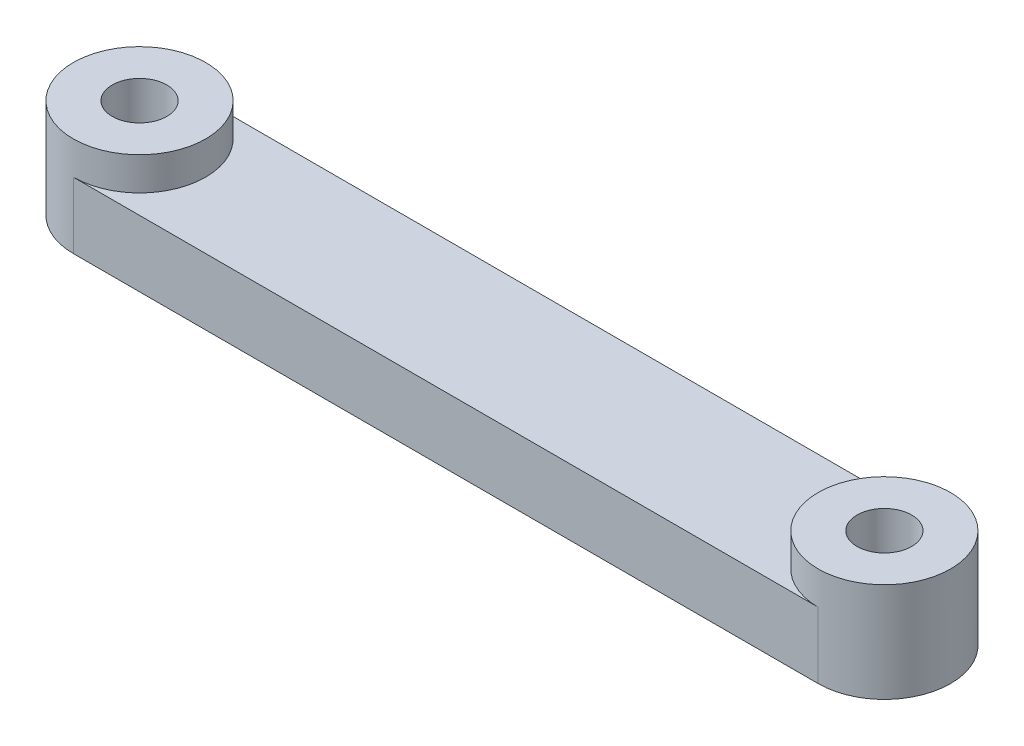
from build123d import *

# Parameters (mm, degrees)
SKETCH1_R           = 1.65
BOSS_EXTRUDE1_DEPTH = 4
SKETCH2_R           = 4
SKETCH2_R_2         = 1.65
BOSS_EXTRUDE2_DEPTH = 2


with BuildPart() as part:
    # Sketch1 → Boss-Extrude1 (new body)
    with BuildSketch(Plane(origin=(0, 0, 0), x_dir=(1, 0, 0), z_dir=(0, 1, 0))):
        with BuildLine():
            Line((-22.5, 4), (22.5, 4))
            ThreePointArc((22.5, 4), (26.5, 0), (22.5, -4))
            Line((22.5, -4), (-22.5, -4))
            ThreePointArc((-22.5, -4), (-26.5, 0), (-22.5, 4))
        make_face()
        with Locations((-22.5, 0)):
            Circle(SKETCH1_R, mode=Mode.SUBTRACT)
        with Locations((22.5, 0)):
            Circle(SKETCH1_R, mode=Mode.SUBTRACT)
    extrude(amount=BOSS_EXTRUDE1_DEPTH)

    # Sketch2 → Boss-Extrude2 (add)
    # profile 1 of 2: a face of its own
    with BuildSketch(Plane(origin=(0, 4, 0), x_dir=(1, 0, 0), z_dir=(0, 1, 0))):
        with Locations((-22.5, 0)):
            Circle(SKETCH2_R)
        with Locations((-22.5, 0)):
            Circle(SKETCH2_R_2, mode=Mode.SUBTRACT)
    # profile 2 of 2: a face of its own
    with BuildSketch(Plane(origin=(0, 4, 0), x_dir=(1, 0, 0), z_dir=(0, 1, 0))):
        with Locations((22.5, 0)):
            Circle(SKETCH2_R)
        with Locations((22.5, 0)):
            Circle(SKETCH2_R_2, mode=Mode.SUBTRACT)
    extrude(amount=BOSS_EXTRUDE2_DEPTH)


solid = part.part
